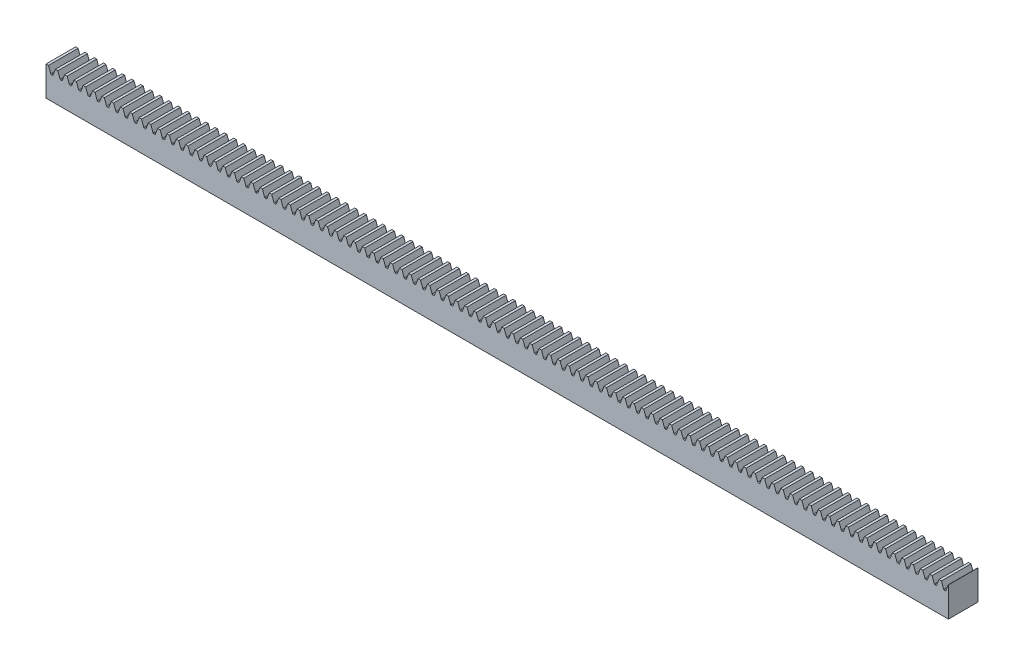
from build123d import *

# Parameters (mm, degrees)
BOSS_EXTRUDE1_DEPTH      = 152.4
BOSS_EXTRUDE1_DEPTH_BACK = 152.4
SKETCH3_W                = 10
SKETCH3_H                = 10
CUT_EXTRUDE1_DEPTH       = 153.563953803
FILLET1_R                = 0.209179931
LPATTERN1_START          = -5
LPATTERN1_DEPTH          = 10


# Read off the part's stored shape, not the designer's step: LPattern1
with BuildPart() as part:
    # Sketch3 → Boss-Extrude1 (new, two sides: drawn at the far end of the back side and taken through both)
    with BuildSketch(Plane(origin=(0, 0, 0), x_dir=(0, 0, -1), z_dir=(1, 0, 0)).offset(-BOSS_EXTRUDE1_DEPTH_BACK)):
        Rectangle(SKETCH3_W, SKETCH3_H)
    extrude(amount=BOSS_EXTRUDE1_DEPTH + BOSS_EXTRUDE1_DEPTH_BACK)

    # Sketch4 → Cut-Extrude1 (cut, symmetric)
    with BuildSketch(Plane.XY):
        Polygon((-151.557145469, 5), (-150.756410953, 2.8), (-150.059144515, 2.8), (-149.25841, 5), align=None)
    extrude(amount=CUT_EXTRUDE1_DEPTH, both=True, mode=Mode.SUBTRACT)

    # Fillet1
    fillet1_edges = [part.edges().sort_by_distance(p)[0] for p in [
        (-150.059144515, 2.8, 0),
        (-150.756410953, 2.8, 0),
    ]]
    fillet(fillet1_edges, radius=FILLET1_R)

    # LPattern1 outline → LPattern1 (cut)
    with BuildSketch(Plane.XY.offset(LPATTERN1_START)):
        with BuildLine():
            ThreePointArc((-147.664916426, 2.937636181), (-147.588332268, 2.837829763), (-147.468351588, 2.8))
            Line((-147.468351588, 2.8), (-147.06402388, 2.8))
            ThreePointArc((-147.06402388, 2.8), (-146.944043201, 2.837829763), (-146.867459042, 2.937636181))
            Line((-146.867459042, 2.937636181), (-146.11682, 5))
            Line((-146.11682, 5), (-148.415555469, 5))
            Line((-148.415555469, 5), (-147.664916426, 2.937636181))
        make_face()
        with BuildLine():
            Line((152.33423, 5), (150.035494531, 5))
            Line((150.035494531, 5), (150.786133574, 2.937636181))
            ThreePointArc((150.786133574, 2.937636181), (150.862717732, 2.837829763), (150.982698412, 2.8))
            Line((150.982698412, 2.8), (151.38702612, 2.8))
            ThreePointArc((151.38702612, 2.8), (151.507006799, 2.837829763), (151.583590958, 2.937636181))
            Line((151.583590958, 2.937636181), (152.33423, 5))
        make_face()
        with BuildLine():
            Line((149.19264, 5), (146.893904531, 5))
            Line((146.893904531, 5), (147.644543574, 2.937636181))
            ThreePointArc((147.644543574, 2.937636181), (147.721127732, 2.837829763), (147.841108412, 2.8))
            Line((147.841108412, 2.8), (148.24543612, 2.8))
            ThreePointArc((148.24543612, 2.8), (148.365416799, 2.837829763), (148.442000958, 2.937636181))
            Line((148.442000958, 2.937636181), (149.19264, 5))
        make_face()
        with BuildLine():
            Line((146.05105, 5), (143.752314531, 5))
            Line((143.752314531, 5), (144.502953574, 2.937636181))
            ThreePointArc((144.502953574, 2.937636181), (144.579537732, 2.837829763), (144.699518412, 2.8))
            Line((144.699518412, 2.8), (145.10384612, 2.8))
            ThreePointArc((145.10384612, 2.8), (145.223826799, 2.837829763), (145.300410958, 2.937636181))
            Line((145.300410958, 2.937636181), (146.05105, 5))
        make_face()
        with BuildLine():
            Line((142.90946, 5), (140.610724531, 5))
            Line((140.610724531, 5), (141.361363574, 2.937636181))
            ThreePointArc((141.361363574, 2.937636181), (141.437947732, 2.837829763), (141.557928412, 2.8))
            Line((141.557928412, 2.8), (141.96225612, 2.8))
            ThreePointArc((141.96225612, 2.8), (142.082236799, 2.837829763), (142.158820958, 2.937636181))
            Line((142.158820958, 2.937636181), (142.90946, 5))
        make_face()
        with BuildLine():
            Line((139.76787, 5), (137.469134531, 5))
            Line((137.469134531, 5), (138.219773574, 2.937636181))
            ThreePointArc((138.219773574, 2.937636181), (138.296357732, 2.837829763), (138.416338412, 2.8))
            Line((138.416338412, 2.8), (138.82066612, 2.8))
            ThreePointArc((138.82066612, 2.8), (138.940646799, 2.837829763), (139.017230958, 2.937636181))
            Line((139.017230958, 2.937636181), (139.76787, 5))
        make_face()
        with BuildLine():
            Line((136.62628, 5), (134.327544531, 5))
            Line((134.327544531, 5), (135.078183574, 2.937636181))
            ThreePointArc((135.078183574, 2.937636181), (135.154767732, 2.837829763), (135.274748412, 2.8))
            Line((135.274748412, 2.8), (135.67907612, 2.8))
            ThreePointArc((135.67907612, 2.8), (135.799056799, 2.837829763), (135.875640958, 2.937636181))
            Line((135.875640958, 2.937636181), (136.62628, 5))
        make_face()
        with BuildLine():
            Line((133.48469, 5), (131.185954531, 5))
            Line((131.185954531, 5), (131.936593574, 2.937636181))
            ThreePointArc((131.936593574, 2.937636181), (132.013177732, 2.837829763), (132.133158412, 2.8))
            Line((132.133158412, 2.8), (132.53748612, 2.8))
            ThreePointArc((132.53748612, 2.8), (132.657466799, 2.837829763), (132.734050958, 2.937636181))
            Line((132.734050958, 2.937636181), (133.48469, 5))
        make_face()
        with BuildLine():
            Line((130.3431, 5), (128.044364531, 5))
            Line((128.044364531, 5), (128.795003574, 2.937636181))
            ThreePointArc((128.795003574, 2.937636181), (128.871587732, 2.837829763), (128.991568412, 2.8))
            Line((128.991568412, 2.8), (129.39589612, 2.8))
            ThreePointArc((129.39589612, 2.8), (129.515876799, 2.837829763), (129.592460958, 2.937636181))
            Line((129.592460958, 2.937636181), (130.3431, 5))
        make_face()
        with BuildLine():
            Line((127.20151, 5), (124.902774531, 5))
            Line((124.902774531, 5), (125.653413574, 2.937636181))
            ThreePointArc((125.653413574, 2.937636181), (125.729997732, 2.837829763), (125.849978412, 2.8))
            Line((125.849978412, 2.8), (126.25430612, 2.8))
            ThreePointArc((126.25430612, 2.8), (126.374286799, 2.837829763), (126.450870958, 2.937636181))
            Line((126.450870958, 2.937636181), (127.20151, 5))
        make_face()
        with BuildLine():
            Line((124.05992, 5), (121.761184531, 5))
            Line((121.761184531, 5), (122.511823574, 2.937636181))
            ThreePointArc((122.511823574, 2.937636181), (122.588407732, 2.837829763), (122.708388412, 2.8))
            Line((122.708388412, 2.8), (123.11271612, 2.8))
            ThreePointArc((123.11271612, 2.8), (123.232696799, 2.837829763), (123.309280958, 2.937636181))
            Line((123.309280958, 2.937636181), (124.05992, 5))
        make_face()
        with BuildLine():
            Line((120.91833, 5), (118.619594531, 5))
            Line((118.619594531, 5), (119.370233574, 2.937636181))
            ThreePointArc((119.370233574, 2.937636181), (119.446817732, 2.837829763), (119.566798412, 2.8))
            Line((119.566798412, 2.8), (119.97112612, 2.8))
            ThreePointArc((119.97112612, 2.8), (120.091106799, 2.837829763), (120.167690958, 2.937636181))
            Line((120.167690958, 2.937636181), (120.91833, 5))
        make_face()
        with BuildLine():
            Line((117.77674, 5), (115.478004531, 5))
            Line((115.478004531, 5), (116.228643574, 2.937636181))
            ThreePointArc((116.228643574, 2.937636181), (116.305227732, 2.837829763), (116.425208412, 2.8))
            Line((116.425208412, 2.8), (116.82953612, 2.8))
            ThreePointArc((116.82953612, 2.8), (116.949516799, 2.837829763), (117.026100958, 2.937636181))
            Line((117.026100958, 2.937636181), (117.77674, 5))
        make_face()
        with BuildLine():
            Line((114.63515, 5), (112.336414531, 5))
            Line((112.336414531, 5), (113.087053574, 2.937636181))
            ThreePointArc((113.087053574, 2.937636181), (113.163637732, 2.837829763), (113.283618412, 2.8))
            Line((113.283618412, 2.8), (113.68794612, 2.8))
            ThreePointArc((113.68794612, 2.8), (113.807926799, 2.837829763), (113.884510958, 2.937636181))
            Line((113.884510958, 2.937636181), (114.63515, 5))
        make_face()
        with BuildLine():
            Line((111.49356, 5), (109.194824531, 5))
            Line((109.194824531, 5), (109.945463574, 2.937636181))
            ThreePointArc((109.945463574, 2.937636181), (110.022047732, 2.837829763), (110.142028412, 2.8))
            Line((110.142028412, 2.8), (110.54635612, 2.8))
            ThreePointArc((110.54635612, 2.8), (110.666336799, 2.837829763), (110.742920958, 2.937636181))
            Line((110.742920958, 2.937636181), (111.49356, 5))
        make_face()
        with BuildLine():
            Line((108.35197, 5), (106.053234531, 5))
            Line((106.053234531, 5), (106.803873574, 2.937636181))
            ThreePointArc((106.803873574, 2.937636181), (106.880457732, 2.837829763), (107.000438412, 2.8))
            Line((107.000438412, 2.8), (107.40476612, 2.8))
            ThreePointArc((107.40476612, 2.8), (107.524746799, 2.837829763), (107.601330958, 2.937636181))
            Line((107.601330958, 2.937636181), (108.35197, 5))
        make_face()
        with BuildLine():
            Line((105.21038, 5), (102.911644531, 5))
            Line((102.911644531, 5), (103.662283574, 2.937636181))
            ThreePointArc((103.662283574, 2.937636181), (103.738867732, 2.837829763), (103.858848412, 2.8))
            Line((103.858848412, 2.8), (104.26317612, 2.8))
            ThreePointArc((104.26317612, 2.8), (104.383156799, 2.837829763), (104.459740958, 2.937636181))
            Line((104.459740958, 2.937636181), (105.21038, 5))
        make_face()
        with BuildLine():
            Line((102.06879, 5), (99.770054531, 5))
            Line((99.770054531, 5), (100.520693574, 2.937636181))
            ThreePointArc((100.520693574, 2.937636181), (100.597277732, 2.837829763), (100.717258412, 2.8))
            Line((100.717258412, 2.8), (101.12158612, 2.8))
            ThreePointArc((101.12158612, 2.8), (101.241566799, 2.837829763), (101.318150958, 2.937636181))
            Line((101.318150958, 2.937636181), (102.06879, 5))
        make_face()
        with BuildLine():
            Line((98.9272, 5), (96.628464531, 5))
            Line((96.628464531, 5), (97.379103574, 2.937636181))
            ThreePointArc((97.379103574, 2.937636181), (97.455687732, 2.837829763), (97.575668412, 2.8))
            Line((97.575668412, 2.8), (97.97999612, 2.8))
            ThreePointArc((97.97999612, 2.8), (98.099976799, 2.837829763), (98.176560958, 2.937636181))
            Line((98.176560958, 2.937636181), (98.9272, 5))
        make_face()
        with BuildLine():
            Line((95.78561, 5), (93.486874531, 5))
            Line((93.486874531, 5), (94.237513574, 2.937636181))
            ThreePointArc((94.237513574, 2.937636181), (94.314097732, 2.837829763), (94.434078412, 2.8))
            Line((94.434078412, 2.8), (94.83840612, 2.8))
            ThreePointArc((94.83840612, 2.8), (94.958386799, 2.837829763), (95.034970958, 2.937636181))
            Line((95.034970958, 2.937636181), (95.78561, 5))
        make_face()
        with BuildLine():
            Line((92.64402, 5), (90.345284531, 5))
            Line((90.345284531, 5), (91.095923574, 2.937636181))
            ThreePointArc((91.095923574, 2.937636181), (91.172507732, 2.837829763), (91.292488412, 2.8))
            Line((91.292488412, 2.8), (91.69681612, 2.8))
            ThreePointArc((91.69681612, 2.8), (91.816796799, 2.837829763), (91.893380958, 2.937636181))
            Line((91.893380958, 2.937636181), (92.64402, 5))
        make_face()
        with BuildLine():
            Line((89.50243, 5), (87.203694531, 5))
            Line((87.203694531, 5), (87.954333574, 2.937636181))
            ThreePointArc((87.954333574, 2.937636181), (88.030917732, 2.837829763), (88.150898412, 2.8))
            Line((88.150898412, 2.8), (88.55522612, 2.8))
            ThreePointArc((88.55522612, 2.8), (88.675206799, 2.837829763), (88.751790958, 2.937636181))
            Line((88.751790958, 2.937636181), (89.50243, 5))
        make_face()
        with BuildLine():
            Line((86.36084, 5), (84.062104531, 5))
            Line((84.062104531, 5), (84.812743574, 2.937636181))
            ThreePointArc((84.812743574, 2.937636181), (84.889327732, 2.837829763), (85.009308412, 2.8))
            Line((85.009308412, 2.8), (85.41363612, 2.8))
            ThreePointArc((85.41363612, 2.8), (85.533616799, 2.837829763), (85.610200958, 2.937636181))
            Line((85.610200958, 2.937636181), (86.36084, 5))
        make_face()
        with BuildLine():
            Line((83.21925, 5), (80.920514531, 5))
            Line((80.920514531, 5), (81.671153574, 2.937636181))
            ThreePointArc((81.671153574, 2.937636181), (81.747737732, 2.837829763), (81.867718412, 2.8))
            Line((81.867718412, 2.8), (82.27204612, 2.8))
            ThreePointArc((82.27204612, 2.8), (82.392026799, 2.837829763), (82.468610958, 2.937636181))
            Line((82.468610958, 2.937636181), (83.21925, 5))
        make_face()
        with BuildLine():
            Line((80.07766, 5), (77.778924531, 5))
            Line((77.778924531, 5), (78.529563574, 2.937636181))
            ThreePointArc((78.529563574, 2.937636181), (78.606147732, 2.837829763), (78.726128412, 2.8))
            Line((78.726128412, 2.8), (79.13045612, 2.8))
            ThreePointArc((79.13045612, 2.8), (79.250436799, 2.837829763), (79.327020958, 2.937636181))
            Line((79.327020958, 2.937636181), (80.07766, 5))
        make_face()
        with BuildLine():
            Line((76.93607, 5), (74.637334531, 5))
            Line((74.637334531, 5), (75.387973574, 2.937636181))
            ThreePointArc((75.387973574, 2.937636181), (75.464557732, 2.837829763), (75.584538412, 2.8))
            Line((75.584538412, 2.8), (75.98886612, 2.8))
            ThreePointArc((75.98886612, 2.8), (76.108846799, 2.837829763), (76.185430958, 2.937636181))
            Line((76.185430958, 2.937636181), (76.93607, 5))
        make_face()
        with BuildLine():
            Line((73.79448, 5), (71.495744531, 5))
            Line((71.495744531, 5), (72.246383574, 2.937636181))
            ThreePointArc((72.246383574, 2.937636181), (72.322967732, 2.837829763), (72.442948412, 2.8))
            Line((72.442948412, 2.8), (72.84727612, 2.8))
            ThreePointArc((72.84727612, 2.8), (72.967256799, 2.837829763), (73.043840958, 2.937636181))
            Line((73.043840958, 2.937636181), (73.79448, 5))
        make_face()
        with BuildLine():
            Line((70.65289, 5), (68.354154531, 5))
            Line((68.354154531, 5), (69.104793574, 2.937636181))
            ThreePointArc((69.104793574, 2.937636181), (69.181377732, 2.837829763), (69.301358412, 2.8))
            Line((69.301358412, 2.8), (69.70568612, 2.8))
            ThreePointArc((69.70568612, 2.8), (69.825666799, 2.837829763), (69.902250958, 2.937636181))
            Line((69.902250958, 2.937636181), (70.65289, 5))
        make_face()
        with BuildLine():
            Line((67.5113, 5), (65.212564531, 5))
            Line((65.212564531, 5), (65.963203574, 2.937636181))
            ThreePointArc((65.963203574, 2.937636181), (66.039787732, 2.837829763), (66.159768412, 2.8))
            Line((66.159768412, 2.8), (66.56409612, 2.8))
            ThreePointArc((66.56409612, 2.8), (66.684076799, 2.837829763), (66.760660958, 2.937636181))
            Line((66.760660958, 2.937636181), (67.5113, 5))
        make_face()
        with BuildLine():
            Line((64.36971, 5), (62.070974531, 5))
            Line((62.070974531, 5), (62.821613574, 2.937636181))
            ThreePointArc((62.821613574, 2.937636181), (62.898197732, 2.837829763), (63.018178412, 2.8))
            Line((63.018178412, 2.8), (63.42250612, 2.8))
            ThreePointArc((63.42250612, 2.8), (63.542486799, 2.837829763), (63.619070958, 2.937636181))
            Line((63.619070958, 2.937636181), (64.36971, 5))
        make_face()
        with BuildLine():
            Line((61.22812, 5), (58.929384531, 5))
            Line((58.929384531, 5), (59.680023574, 2.937636181))
            ThreePointArc((59.680023574, 2.937636181), (59.756607732, 2.837829763), (59.876588412, 2.8))
            Line((59.876588412, 2.8), (60.28091612, 2.8))
            ThreePointArc((60.28091612, 2.8), (60.400896799, 2.837829763), (60.477480958, 2.937636181))
            Line((60.477480958, 2.937636181), (61.22812, 5))
        make_face()
        with BuildLine():
            Line((58.08653, 5), (55.787794531, 5))
            Line((55.787794531, 5), (56.538433574, 2.937636181))
            ThreePointArc((56.538433574, 2.937636181), (56.615017732, 2.837829763), (56.734998412, 2.8))
            Line((56.734998412, 2.8), (57.13932612, 2.8))
            ThreePointArc((57.13932612, 2.8), (57.259306799, 2.837829763), (57.335890958, 2.937636181))
            Line((57.335890958, 2.937636181), (58.08653, 5))
        make_face()
        with BuildLine():
            Line((54.94494, 5), (52.646204531, 5))
            Line((52.646204531, 5), (53.396843574, 2.937636181))
            ThreePointArc((53.396843574, 2.937636181), (53.473427732, 2.837829763), (53.593408412, 2.8))
            Line((53.593408412, 2.8), (53.99773612, 2.8))
            ThreePointArc((53.99773612, 2.8), (54.117716799, 2.837829763), (54.194300958, 2.937636181))
            Line((54.194300958, 2.937636181), (54.94494, 5))
        make_face()
        with BuildLine():
            Line((51.80335, 5), (49.504614531, 5))
            Line((49.504614531, 5), (50.255253574, 2.937636181))
            ThreePointArc((50.255253574, 2.937636181), (50.331837732, 2.837829763), (50.451818412, 2.8))
            Line((50.451818412, 2.8), (50.85614612, 2.8))
            ThreePointArc((50.85614612, 2.8), (50.976126799, 2.837829763), (51.052710958, 2.937636181))
            Line((51.052710958, 2.937636181), (51.80335, 5))
        make_face()
        with BuildLine():
            Line((48.66176, 5), (46.363024531, 5))
            Line((46.363024531, 5), (47.113663574, 2.937636181))
            ThreePointArc((47.113663574, 2.937636181), (47.190247732, 2.837829763), (47.310228412, 2.8))
            Line((47.310228412, 2.8), (47.71455612, 2.8))
            ThreePointArc((47.71455612, 2.8), (47.834536799, 2.837829763), (47.911120958, 2.937636181))
            Line((47.911120958, 2.937636181), (48.66176, 5))
        make_face()
        with BuildLine():
            Line((45.52017, 5), (43.221434531, 5))
            Line((43.221434531, 5), (43.972073574, 2.937636181))
            ThreePointArc((43.972073574, 2.937636181), (44.048657732, 2.837829763), (44.168638412, 2.8))
            Line((44.168638412, 2.8), (44.57296612, 2.8))
            ThreePointArc((44.57296612, 2.8), (44.692946799, 2.837829763), (44.769530958, 2.937636181))
            Line((44.769530958, 2.937636181), (45.52017, 5))
        make_face()
        with BuildLine():
            Line((42.37858, 5), (40.079844531, 5))
            Line((40.079844531, 5), (40.830483574, 2.937636181))
            ThreePointArc((40.830483574, 2.937636181), (40.907067732, 2.837829763), (41.027048412, 2.8))
            Line((41.027048412, 2.8), (41.43137612, 2.8))
            ThreePointArc((41.43137612, 2.8), (41.551356799, 2.837829763), (41.627940958, 2.937636181))
            Line((41.627940958, 2.937636181), (42.37858, 5))
        make_face()
        with BuildLine():
            Line((39.23699, 5), (36.938254531, 5))
            Line((36.938254531, 5), (37.688893574, 2.937636181))
            ThreePointArc((37.688893574, 2.937636181), (37.765477732, 2.837829763), (37.885458412, 2.8))
            Line((37.885458412, 2.8), (38.28978612, 2.8))
            ThreePointArc((38.28978612, 2.8), (38.409766799, 2.837829763), (38.486350958, 2.937636181))
            Line((38.486350958, 2.937636181), (39.23699, 5))
        make_face()
        with BuildLine():
            Line((36.0954, 5), (33.796664531, 5))
            Line((33.796664531, 5), (34.547303574, 2.937636181))
            ThreePointArc((34.547303574, 2.937636181), (34.623887732, 2.837829763), (34.743868412, 2.8))
            Line((34.743868412, 2.8), (35.14819612, 2.8))
            ThreePointArc((35.14819612, 2.8), (35.268176799, 2.837829763), (35.344760958, 2.937636181))
            Line((35.344760958, 2.937636181), (36.0954, 5))
        make_face()
        with BuildLine():
            Line((32.95381, 5), (30.655074531, 5))
            Line((30.655074531, 5), (31.405713574, 2.937636181))
            ThreePointArc((31.405713574, 2.937636181), (31.482297732, 2.837829763), (31.602278412, 2.8))
            Line((31.602278412, 2.8), (32.00660612, 2.8))
            ThreePointArc((32.00660612, 2.8), (32.126586799, 2.837829763), (32.203170958, 2.937636181))
            Line((32.203170958, 2.937636181), (32.95381, 5))
        make_face()
        with BuildLine():
            Line((29.81222, 5), (27.513484531, 5))
            Line((27.513484531, 5), (28.264123574, 2.937636181))
            ThreePointArc((28.264123574, 2.937636181), (28.340707732, 2.837829763), (28.460688412, 2.8))
            Line((28.460688412, 2.8), (28.86501612, 2.8))
            ThreePointArc((28.86501612, 2.8), (28.984996799, 2.837829763), (29.061580958, 2.937636181))
            Line((29.061580958, 2.937636181), (29.81222, 5))
        make_face()
        with BuildLine():
            Line((26.67063, 5), (24.371894531, 5))
            Line((24.371894531, 5), (25.122533574, 2.937636181))
            ThreePointArc((25.122533574, 2.937636181), (25.199117732, 2.837829763), (25.319098412, 2.8))
            Line((25.319098412, 2.8), (25.72342612, 2.8))
            ThreePointArc((25.72342612, 2.8), (25.843406799, 2.837829763), (25.919990958, 2.937636181))
            Line((25.919990958, 2.937636181), (26.67063, 5))
        make_face()
        with BuildLine():
            Line((23.52904, 5), (21.230304531, 5))
            Line((21.230304531, 5), (21.980943574, 2.937636181))
            ThreePointArc((21.980943574, 2.937636181), (22.057527732, 2.837829763), (22.177508412, 2.8))
            Line((22.177508412, 2.8), (22.58183612, 2.8))
            ThreePointArc((22.58183612, 2.8), (22.701816799, 2.837829763), (22.778400958, 2.937636181))
            Line((22.778400958, 2.937636181), (23.52904, 5))
        make_face()
        with BuildLine():
            Line((20.38745, 5), (18.088714531, 5))
            Line((18.088714531, 5), (18.839353574, 2.937636181))
            ThreePointArc((18.839353574, 2.937636181), (18.915937732, 2.837829763), (19.035918412, 2.8))
            Line((19.035918412, 2.8), (19.44024612, 2.8))
            ThreePointArc((19.44024612, 2.8), (19.560226799, 2.837829763), (19.636810958, 2.937636181))
            Line((19.636810958, 2.937636181), (20.38745, 5))
        make_face()
        with BuildLine():
            Line((17.24586, 5), (14.947124531, 5))
            Line((14.947124531, 5), (15.697763574, 2.937636181))
            ThreePointArc((15.697763574, 2.937636181), (15.774347732, 2.837829763), (15.894328412, 2.8))
            Line((15.894328412, 2.8), (16.29865612, 2.8))
            ThreePointArc((16.29865612, 2.8), (16.418636799, 2.837829763), (16.495220958, 2.937636181))
            Line((16.495220958, 2.937636181), (17.24586, 5))
        make_face()
        with BuildLine():
            Line((14.10427, 5), (11.805534531, 5))
            Line((11.805534531, 5), (12.556173574, 2.937636181))
            ThreePointArc((12.556173574, 2.937636181), (12.632757732, 2.837829763), (12.752738412, 2.8))
            Line((12.752738412, 2.8), (13.15706612, 2.8))
            ThreePointArc((13.15706612, 2.8), (13.277046799, 2.837829763), (13.353630958, 2.937636181))
            Line((13.353630958, 2.937636181), (14.10427, 5))
        make_face()
        with BuildLine():
            Line((10.96268, 5), (8.663944531, 5))
            Line((8.663944531, 5), (9.414583574, 2.937636181))
            ThreePointArc((9.414583574, 2.937636181), (9.491167732, 2.837829763), (9.611148412, 2.8))
            Line((9.611148412, 2.8), (10.01547612, 2.8))
            ThreePointArc((10.01547612, 2.8), (10.135456799, 2.837829763), (10.212040958, 2.937636181))
            Line((10.212040958, 2.937636181), (10.96268, 5))
        make_face()
        with BuildLine():
            Line((7.82109, 5), (5.522354531, 5))
            Line((5.522354531, 5), (6.272993574, 2.937636181))
            ThreePointArc((6.272993574, 2.937636181), (6.349577732, 2.837829763), (6.469558412, 2.8))
            Line((6.469558412, 2.8), (6.87388612, 2.8))
            ThreePointArc((6.87388612, 2.8), (6.993866799, 2.837829763), (7.070450958, 2.937636181))
            Line((7.070450958, 2.937636181), (7.82109, 5))
        make_face()
        with BuildLine():
            Line((4.6795, 5), (2.380764531, 5))
            Line((2.380764531, 5), (3.131403574, 2.937636181))
            ThreePointArc((3.131403574, 2.937636181), (3.207987732, 2.837829763), (3.327968412, 2.8))
            Line((3.327968412, 2.8), (3.73229612, 2.8))
            ThreePointArc((3.73229612, 2.8), (3.852276799, 2.837829763), (3.928860958, 2.937636181))
            Line((3.928860958, 2.937636181), (4.6795, 5))
        make_face()
        with BuildLine():
            Line((1.53791, 5), (-0.760825469, 5))
            Line((-0.760825469, 5), (-0.010186426, 2.937636181))
            ThreePointArc((-0.010186426, 2.937636181), (0.066397732, 2.837829763), (0.186378412, 2.8))
            Line((0.186378412, 2.8), (0.59070612, 2.8))
            ThreePointArc((0.59070612, 2.8), (0.710686799, 2.837829763), (0.787270958, 2.937636181))
            Line((0.787270958, 2.937636181), (1.53791, 5))
        make_face()
        with BuildLine():
            Line((-1.60368, 5), (-3.902415469, 5))
            Line((-3.902415469, 5), (-3.151776426, 2.937636181))
            ThreePointArc((-3.151776426, 2.937636181), (-3.075192268, 2.837829763), (-2.955211588, 2.8))
            Line((-2.955211588, 2.8), (-2.55088388, 2.8))
            ThreePointArc((-2.55088388, 2.8), (-2.430903201, 2.837829763), (-2.354319042, 2.937636181))
            Line((-2.354319042, 2.937636181), (-1.60368, 5))
        make_face()
        with BuildLine():
            Line((-4.74527, 5), (-7.044005469, 5))
            Line((-7.044005469, 5), (-6.293366426, 2.937636181))
            ThreePointArc((-6.293366426, 2.937636181), (-6.216782268, 2.837829763), (-6.096801588, 2.8))
            Line((-6.096801588, 2.8), (-5.69247388, 2.8))
            ThreePointArc((-5.69247388, 2.8), (-5.572493201, 2.837829763), (-5.495909042, 2.937636181))
            Line((-5.495909042, 2.937636181), (-4.74527, 5))
        make_face()
        with BuildLine():
            Line((-7.88686, 5), (-10.185595469, 5))
            Line((-10.185595469, 5), (-9.434956426, 2.937636181))
            ThreePointArc((-9.434956426, 2.937636181), (-9.358372268, 2.837829763), (-9.238391588, 2.8))
            Line((-9.238391588, 2.8), (-8.83406388, 2.8))
            ThreePointArc((-8.83406388, 2.8), (-8.714083201, 2.837829763), (-8.637499042, 2.937636181))
            Line((-8.637499042, 2.937636181), (-7.88686, 5))
        make_face()
        with BuildLine():
            Line((-11.02845, 5), (-13.327185469, 5))
            Line((-13.327185469, 5), (-12.576546426, 2.937636181))
            ThreePointArc((-12.576546426, 2.937636181), (-12.499962268, 2.837829763), (-12.379981588, 2.8))
            Line((-12.379981588, 2.8), (-11.97565388, 2.8))
            ThreePointArc((-11.97565388, 2.8), (-11.855673201, 2.837829763), (-11.779089042, 2.937636181))
            Line((-11.779089042, 2.937636181), (-11.02845, 5))
        make_face()
        with BuildLine():
            Line((-14.17004, 5), (-16.468775469, 5))
            Line((-16.468775469, 5), (-15.718136426, 2.937636181))
            ThreePointArc((-15.718136426, 2.937636181), (-15.641552268, 2.837829763), (-15.521571588, 2.8))
            Line((-15.521571588, 2.8), (-15.11724388, 2.8))
            ThreePointArc((-15.11724388, 2.8), (-14.997263201, 2.837829763), (-14.920679042, 2.937636181))
            Line((-14.920679042, 2.937636181), (-14.17004, 5))
        make_face()
        with BuildLine():
            Line((-17.31163, 5), (-19.610365469, 5))
            Line((-19.610365469, 5), (-18.859726426, 2.937636181))
            ThreePointArc((-18.859726426, 2.937636181), (-18.783142268, 2.837829763), (-18.663161588, 2.8))
            Line((-18.663161588, 2.8), (-18.25883388, 2.8))
            ThreePointArc((-18.25883388, 2.8), (-18.138853201, 2.837829763), (-18.062269042, 2.937636181))
            Line((-18.062269042, 2.937636181), (-17.31163, 5))
        make_face()
        with BuildLine():
            Line((-20.45322, 5), (-22.751955469, 5))
            Line((-22.751955469, 5), (-22.001316426, 2.937636181))
            ThreePointArc((-22.001316426, 2.937636181), (-21.924732268, 2.837829763), (-21.804751588, 2.8))
            Line((-21.804751588, 2.8), (-21.40042388, 2.8))
            ThreePointArc((-21.40042388, 2.8), (-21.280443201, 2.837829763), (-21.203859042, 2.937636181))
            Line((-21.203859042, 2.937636181), (-20.45322, 5))
        make_face()
        with BuildLine():
            Line((-23.59481, 5), (-25.893545469, 5))
            Line((-25.893545469, 5), (-25.142906426, 2.937636181))
            ThreePointArc((-25.142906426, 2.937636181), (-25.066322268, 2.837829763), (-24.946341588, 2.8))
            Line((-24.946341588, 2.8), (-24.54201388, 2.8))
            ThreePointArc((-24.54201388, 2.8), (-24.422033201, 2.837829763), (-24.345449042, 2.937636181))
            Line((-24.345449042, 2.937636181), (-23.59481, 5))
        make_face()
        with BuildLine():
            Line((-26.7364, 5), (-29.035135469, 5))
            Line((-29.035135469, 5), (-28.284496426, 2.937636181))
            ThreePointArc((-28.284496426, 2.937636181), (-28.207912268, 2.837829763), (-28.087931588, 2.8))
            Line((-28.087931588, 2.8), (-27.68360388, 2.8))
            ThreePointArc((-27.68360388, 2.8), (-27.563623201, 2.837829763), (-27.487039042, 2.937636181))
            Line((-27.487039042, 2.937636181), (-26.7364, 5))
        make_face()
        with BuildLine():
            Line((-29.87799, 5), (-32.176725469, 5))
            Line((-32.176725469, 5), (-31.426086426, 2.937636181))
            ThreePointArc((-31.426086426, 2.937636181), (-31.349502268, 2.837829763), (-31.229521588, 2.8))
            Line((-31.229521588, 2.8), (-30.82519388, 2.8))
            ThreePointArc((-30.82519388, 2.8), (-30.705213201, 2.837829763), (-30.628629042, 2.937636181))
            Line((-30.628629042, 2.937636181), (-29.87799, 5))
        make_face()
        with BuildLine():
            Line((-33.01958, 5), (-35.318315469, 5))
            Line((-35.318315469, 5), (-34.567676426, 2.937636181))
            ThreePointArc((-34.567676426, 2.937636181), (-34.491092268, 2.837829763), (-34.371111588, 2.8))
            Line((-34.371111588, 2.8), (-33.96678388, 2.8))
            ThreePointArc((-33.96678388, 2.8), (-33.846803201, 2.837829763), (-33.770219042, 2.937636181))
            Line((-33.770219042, 2.937636181), (-33.01958, 5))
        make_face()
        with BuildLine():
            Line((-36.16117, 5), (-38.459905469, 5))
            Line((-38.459905469, 5), (-37.709266426, 2.937636181))
            ThreePointArc((-37.709266426, 2.937636181), (-37.632682268, 2.837829763), (-37.512701588, 2.8))
            Line((-37.512701588, 2.8), (-37.10837388, 2.8))
            ThreePointArc((-37.10837388, 2.8), (-36.988393201, 2.837829763), (-36.911809042, 2.937636181))
            Line((-36.911809042, 2.937636181), (-36.16117, 5))
        make_face()
        with BuildLine():
            Line((-39.30276, 5), (-41.601495469, 5))
            Line((-41.601495469, 5), (-40.850856426, 2.937636181))
            ThreePointArc((-40.850856426, 2.937636181), (-40.774272268, 2.837829763), (-40.654291588, 2.8))
            Line((-40.654291588, 2.8), (-40.24996388, 2.8))
            ThreePointArc((-40.24996388, 2.8), (-40.129983201, 2.837829763), (-40.053399042, 2.937636181))
            Line((-40.053399042, 2.937636181), (-39.30276, 5))
        make_face()
        with BuildLine():
            Line((-42.44435, 5), (-44.743085469, 5))
            Line((-44.743085469, 5), (-43.992446426, 2.937636181))
            ThreePointArc((-43.992446426, 2.937636181), (-43.915862268, 2.837829763), (-43.795881588, 2.8))
            Line((-43.795881588, 2.8), (-43.39155388, 2.8))
            ThreePointArc((-43.39155388, 2.8), (-43.271573201, 2.837829763), (-43.194989042, 2.937636181))
            Line((-43.194989042, 2.937636181), (-42.44435, 5))
        make_face()
        with BuildLine():
            Line((-45.58594, 5), (-47.884675469, 5))
            Line((-47.884675469, 5), (-47.134036426, 2.937636181))
            ThreePointArc((-47.134036426, 2.937636181), (-47.057452268, 2.837829763), (-46.937471588, 2.8))
            Line((-46.937471588, 2.8), (-46.53314388, 2.8))
            ThreePointArc((-46.53314388, 2.8), (-46.413163201, 2.837829763), (-46.336579042, 2.937636181))
            Line((-46.336579042, 2.937636181), (-45.58594, 5))
        make_face()
        with BuildLine():
            Line((-48.72753, 5), (-51.026265469, 5))
            Line((-51.026265469, 5), (-50.275626426, 2.937636181))
            ThreePointArc((-50.275626426, 2.937636181), (-50.199042268, 2.837829763), (-50.079061588, 2.8))
            Line((-50.079061588, 2.8), (-49.67473388, 2.8))
            ThreePointArc((-49.67473388, 2.8), (-49.554753201, 2.837829763), (-49.478169042, 2.937636181))
            Line((-49.478169042, 2.937636181), (-48.72753, 5))
        make_face()
        with BuildLine():
            Line((-51.86912, 5), (-54.167855469, 5))
            Line((-54.167855469, 5), (-53.417216426, 2.937636181))
            ThreePointArc((-53.417216426, 2.937636181), (-53.340632268, 2.837829763), (-53.220651588, 2.8))
            Line((-53.220651588, 2.8), (-52.81632388, 2.8))
            ThreePointArc((-52.81632388, 2.8), (-52.696343201, 2.837829763), (-52.619759042, 2.937636181))
            Line((-52.619759042, 2.937636181), (-51.86912, 5))
        make_face()
        with BuildLine():
            Line((-55.01071, 5), (-57.309445469, 5))
            Line((-57.309445469, 5), (-56.558806426, 2.937636181))
            ThreePointArc((-56.558806426, 2.937636181), (-56.482222268, 2.837829763), (-56.362241588, 2.8))
            Line((-56.362241588, 2.8), (-55.95791388, 2.8))
            ThreePointArc((-55.95791388, 2.8), (-55.837933201, 2.837829763), (-55.761349042, 2.937636181))
            Line((-55.761349042, 2.937636181), (-55.01071, 5))
        make_face()
        with BuildLine():
            Line((-58.1523, 5), (-60.451035469, 5))
            Line((-60.451035469, 5), (-59.700396426, 2.937636181))
            ThreePointArc((-59.700396426, 2.937636181), (-59.623812268, 2.837829763), (-59.503831588, 2.8))
            Line((-59.503831588, 2.8), (-59.09950388, 2.8))
            ThreePointArc((-59.09950388, 2.8), (-58.979523201, 2.837829763), (-58.902939042, 2.937636181))
            Line((-58.902939042, 2.937636181), (-58.1523, 5))
        make_face()
        with BuildLine():
            Line((-61.29389, 5), (-63.592625469, 5))
            Line((-63.592625469, 5), (-62.841986426, 2.937636181))
            ThreePointArc((-62.841986426, 2.937636181), (-62.765402268, 2.837829763), (-62.645421588, 2.8))
            Line((-62.645421588, 2.8), (-62.24109388, 2.8))
            ThreePointArc((-62.24109388, 2.8), (-62.121113201, 2.837829763), (-62.044529042, 2.937636181))
            Line((-62.044529042, 2.937636181), (-61.29389, 5))
        make_face()
        with BuildLine():
            Line((-64.43548, 5), (-66.734215469, 5))
            Line((-66.734215469, 5), (-65.983576426, 2.937636181))
            ThreePointArc((-65.983576426, 2.937636181), (-65.906992268, 2.837829763), (-65.787011588, 2.8))
            Line((-65.787011588, 2.8), (-65.38268388, 2.8))
            ThreePointArc((-65.38268388, 2.8), (-65.262703201, 2.837829763), (-65.186119042, 2.937636181))
            Line((-65.186119042, 2.937636181), (-64.43548, 5))
        make_face()
        with BuildLine():
            Line((-67.57707, 5), (-69.875805469, 5))
            Line((-69.875805469, 5), (-69.125166426, 2.937636181))
            ThreePointArc((-69.125166426, 2.937636181), (-69.048582268, 2.837829763), (-68.928601588, 2.8))
            Line((-68.928601588, 2.8), (-68.52427388, 2.8))
            ThreePointArc((-68.52427388, 2.8), (-68.404293201, 2.837829763), (-68.327709042, 2.937636181))
            Line((-68.327709042, 2.937636181), (-67.57707, 5))
        make_face()
        with BuildLine():
            Line((-70.71866, 5), (-73.017395469, 5))
            Line((-73.017395469, 5), (-72.266756426, 2.937636181))
            ThreePointArc((-72.266756426, 2.937636181), (-72.190172268, 2.837829763), (-72.070191588, 2.8))
            Line((-72.070191588, 2.8), (-71.66586388, 2.8))
            ThreePointArc((-71.66586388, 2.8), (-71.545883201, 2.837829763), (-71.469299042, 2.937636181))
            Line((-71.469299042, 2.937636181), (-70.71866, 5))
        make_face()
        with BuildLine():
            Line((-73.86025, 5), (-76.158985469, 5))
            Line((-76.158985469, 5), (-75.408346426, 2.937636181))
            ThreePointArc((-75.408346426, 2.937636181), (-75.331762268, 2.837829763), (-75.211781588, 2.8))
            Line((-75.211781588, 2.8), (-74.80745388, 2.8))
            ThreePointArc((-74.80745388, 2.8), (-74.687473201, 2.837829763), (-74.610889042, 2.937636181))
            Line((-74.610889042, 2.937636181), (-73.86025, 5))
        make_face()
        with BuildLine():
            Line((-77.00184, 5), (-79.300575469, 5))
            Line((-79.300575469, 5), (-78.549936426, 2.937636181))
            ThreePointArc((-78.549936426, 2.937636181), (-78.473352268, 2.837829763), (-78.353371588, 2.8))
            Line((-78.353371588, 2.8), (-77.94904388, 2.8))
            ThreePointArc((-77.94904388, 2.8), (-77.829063201, 2.837829763), (-77.752479042, 2.937636181))
            Line((-77.752479042, 2.937636181), (-77.00184, 5))
        make_face()
        with BuildLine():
            Line((-80.14343, 5), (-82.442165469, 5))
            Line((-82.442165469, 5), (-81.691526426, 2.937636181))
            ThreePointArc((-81.691526426, 2.937636181), (-81.614942268, 2.837829763), (-81.494961588, 2.8))
            Line((-81.494961588, 2.8), (-81.09063388, 2.8))
            ThreePointArc((-81.09063388, 2.8), (-80.970653201, 2.837829763), (-80.894069042, 2.937636181))
            Line((-80.894069042, 2.937636181), (-80.14343, 5))
        make_face()
        with BuildLine():
            Line((-83.28502, 5), (-85.583755469, 5))
            Line((-85.583755469, 5), (-84.833116426, 2.937636181))
            ThreePointArc((-84.833116426, 2.937636181), (-84.756532268, 2.837829763), (-84.636551588, 2.8))
            Line((-84.636551588, 2.8), (-84.23222388, 2.8))
            ThreePointArc((-84.23222388, 2.8), (-84.112243201, 2.837829763), (-84.035659042, 2.937636181))
            Line((-84.035659042, 2.937636181), (-83.28502, 5))
        make_face()
        with BuildLine():
            Line((-86.42661, 5), (-88.725345469, 5))
            Line((-88.725345469, 5), (-87.974706426, 2.937636181))
            ThreePointArc((-87.974706426, 2.937636181), (-87.898122268, 2.837829763), (-87.778141588, 2.8))
            Line((-87.778141588, 2.8), (-87.37381388, 2.8))
            ThreePointArc((-87.37381388, 2.8), (-87.253833201, 2.837829763), (-87.177249042, 2.937636181))
            Line((-87.177249042, 2.937636181), (-86.42661, 5))
        make_face()
        with BuildLine():
            Line((-89.5682, 5), (-91.866935469, 5))
            Line((-91.866935469, 5), (-91.116296426, 2.937636181))
            ThreePointArc((-91.116296426, 2.937636181), (-91.039712268, 2.837829763), (-90.919731588, 2.8))
            Line((-90.919731588, 2.8), (-90.51540388, 2.8))
            ThreePointArc((-90.51540388, 2.8), (-90.395423201, 2.837829763), (-90.318839042, 2.937636181))
            Line((-90.318839042, 2.937636181), (-89.5682, 5))
        make_face()
        with BuildLine():
            Line((-92.70979, 5), (-95.008525469, 5))
            Line((-95.008525469, 5), (-94.257886426, 2.937636181))
            ThreePointArc((-94.257886426, 2.937636181), (-94.181302268, 2.837829763), (-94.061321588, 2.8))
            Line((-94.061321588, 2.8), (-93.65699388, 2.8))
            ThreePointArc((-93.65699388, 2.8), (-93.537013201, 2.837829763), (-93.460429042, 2.937636181))
            Line((-93.460429042, 2.937636181), (-92.70979, 5))
        make_face()
        with BuildLine():
            Line((-95.85138, 5), (-98.150115469, 5))
            Line((-98.150115469, 5), (-97.399476426, 2.937636181))
            ThreePointArc((-97.399476426, 2.937636181), (-97.322892268, 2.837829763), (-97.202911588, 2.8))
            Line((-97.202911588, 2.8), (-96.79858388, 2.8))
            ThreePointArc((-96.79858388, 2.8), (-96.678603201, 2.837829763), (-96.602019042, 2.937636181))
            Line((-96.602019042, 2.937636181), (-95.85138, 5))
        make_face()
        with BuildLine():
            Line((-98.99297, 5), (-101.291705469, 5))
            Line((-101.291705469, 5), (-100.541066426, 2.937636181))
            ThreePointArc((-100.541066426, 2.937636181), (-100.464482268, 2.837829763), (-100.344501588, 2.8))
            Line((-100.344501588, 2.8), (-99.94017388, 2.8))
            ThreePointArc((-99.94017388, 2.8), (-99.820193201, 2.837829763), (-99.743609042, 2.937636181))
            Line((-99.743609042, 2.937636181), (-98.99297, 5))
        make_face()
        with BuildLine():
            Line((-102.13456, 5), (-104.433295469, 5))
            Line((-104.433295469, 5), (-103.682656426, 2.937636181))
            ThreePointArc((-103.682656426, 2.937636181), (-103.606072268, 2.837829763), (-103.486091588, 2.8))
            Line((-103.486091588, 2.8), (-103.08176388, 2.8))
            ThreePointArc((-103.08176388, 2.8), (-102.961783201, 2.837829763), (-102.885199042, 2.937636181))
            Line((-102.885199042, 2.937636181), (-102.13456, 5))
        make_face()
        with BuildLine():
            Line((-105.27615, 5), (-107.574885469, 5))
            Line((-107.574885469, 5), (-106.824246426, 2.937636181))
            ThreePointArc((-106.824246426, 2.937636181), (-106.747662268, 2.837829763), (-106.627681588, 2.8))
            Line((-106.627681588, 2.8), (-106.22335388, 2.8))
            ThreePointArc((-106.22335388, 2.8), (-106.103373201, 2.837829763), (-106.026789042, 2.937636181))
            Line((-106.026789042, 2.937636181), (-105.27615, 5))
        make_face()
        with BuildLine():
            Line((-108.41774, 5), (-110.716475469, 5))
            Line((-110.716475469, 5), (-109.965836426, 2.937636181))
            ThreePointArc((-109.965836426, 2.937636181), (-109.889252268, 2.837829763), (-109.769271588, 2.8))
            Line((-109.769271588, 2.8), (-109.36494388, 2.8))
            ThreePointArc((-109.36494388, 2.8), (-109.244963201, 2.837829763), (-109.168379042, 2.937636181))
            Line((-109.168379042, 2.937636181), (-108.41774, 5))
        make_face()
        with BuildLine():
            Line((-111.55933, 5), (-113.858065469, 5))
            Line((-113.858065469, 5), (-113.107426426, 2.937636181))
            ThreePointArc((-113.107426426, 2.937636181), (-113.030842268, 2.837829763), (-112.910861588, 2.8))
            Line((-112.910861588, 2.8), (-112.50653388, 2.8))
            ThreePointArc((-112.50653388, 2.8), (-112.386553201, 2.837829763), (-112.309969042, 2.937636181))
            Line((-112.309969042, 2.937636181), (-111.55933, 5))
        make_face()
        with BuildLine():
            Line((-114.70092, 5), (-116.999655469, 5))
            Line((-116.999655469, 5), (-116.249016426, 2.937636181))
            ThreePointArc((-116.249016426, 2.937636181), (-116.172432268, 2.837829763), (-116.052451588, 2.8))
            Line((-116.052451588, 2.8), (-115.64812388, 2.8))
            ThreePointArc((-115.64812388, 2.8), (-115.528143201, 2.837829763), (-115.451559042, 2.937636181))
            Line((-115.451559042, 2.937636181), (-114.70092, 5))
        make_face()
        with BuildLine():
            Line((-117.84251, 5), (-120.141245469, 5))
            Line((-120.141245469, 5), (-119.390606426, 2.937636181))
            ThreePointArc((-119.390606426, 2.937636181), (-119.314022268, 2.837829763), (-119.194041588, 2.8))
            Line((-119.194041588, 2.8), (-118.78971388, 2.8))
            ThreePointArc((-118.78971388, 2.8), (-118.669733201, 2.837829763), (-118.593149042, 2.937636181))
            Line((-118.593149042, 2.937636181), (-117.84251, 5))
        make_face()
        with BuildLine():
            Line((-120.9841, 5), (-123.282835469, 5))
            Line((-123.282835469, 5), (-122.532196426, 2.937636181))
            ThreePointArc((-122.532196426, 2.937636181), (-122.455612268, 2.837829763), (-122.335631588, 2.8))
            Line((-122.335631588, 2.8), (-121.93130388, 2.8))
            ThreePointArc((-121.93130388, 2.8), (-121.811323201, 2.837829763), (-121.734739042, 2.937636181))
            Line((-121.734739042, 2.937636181), (-120.9841, 5))
        make_face()
        with BuildLine():
            Line((-124.12569, 5), (-126.424425469, 5))
            Line((-126.424425469, 5), (-125.673786426, 2.937636181))
            ThreePointArc((-125.673786426, 2.937636181), (-125.597202268, 2.837829763), (-125.477221588, 2.8))
            Line((-125.477221588, 2.8), (-125.07289388, 2.8))
            ThreePointArc((-125.07289388, 2.8), (-124.952913201, 2.837829763), (-124.876329042, 2.937636181))
            Line((-124.876329042, 2.937636181), (-124.12569, 5))
        make_face()
        with BuildLine():
            Line((-127.26728, 5), (-129.566015469, 5))
            Line((-129.566015469, 5), (-128.815376426, 2.937636181))
            ThreePointArc((-128.815376426, 2.937636181), (-128.738792268, 2.837829763), (-128.618811588, 2.8))
            Line((-128.618811588, 2.8), (-128.21448388, 2.8))
            ThreePointArc((-128.21448388, 2.8), (-128.094503201, 2.837829763), (-128.017919042, 2.937636181))
            Line((-128.017919042, 2.937636181), (-127.26728, 5))
        make_face()
        with BuildLine():
            Line((-130.40887, 5), (-132.707605469, 5))
            Line((-132.707605469, 5), (-131.956966426, 2.937636181))
            ThreePointArc((-131.956966426, 2.937636181), (-131.880382268, 2.837829763), (-131.760401588, 2.8))
            Line((-131.760401588, 2.8), (-131.35607388, 2.8))
            ThreePointArc((-131.35607388, 2.8), (-131.236093201, 2.837829763), (-131.159509042, 2.937636181))
            Line((-131.159509042, 2.937636181), (-130.40887, 5))
        make_face()
        with BuildLine():
            Line((-133.55046, 5), (-135.849195469, 5))
            Line((-135.849195469, 5), (-135.098556426, 2.937636181))
            ThreePointArc((-135.098556426, 2.937636181), (-135.021972268, 2.837829763), (-134.901991588, 2.8))
            Line((-134.901991588, 2.8), (-134.49766388, 2.8))
            ThreePointArc((-134.49766388, 2.8), (-134.377683201, 2.837829763), (-134.301099042, 2.937636181))
            Line((-134.301099042, 2.937636181), (-133.55046, 5))
        make_face()
        with BuildLine():
            Line((-136.69205, 5), (-138.990785469, 5))
            Line((-138.990785469, 5), (-138.240146426, 2.937636181))
            ThreePointArc((-138.240146426, 2.937636181), (-138.163562268, 2.837829763), (-138.043581588, 2.8))
            Line((-138.043581588, 2.8), (-137.63925388, 2.8))
            ThreePointArc((-137.63925388, 2.8), (-137.519273201, 2.837829763), (-137.442689042, 2.937636181))
            Line((-137.442689042, 2.937636181), (-136.69205, 5))
        make_face()
        with BuildLine():
            Line((-139.83364, 5), (-142.132375469, 5))
            Line((-142.132375469, 5), (-141.381736426, 2.937636181))
            ThreePointArc((-141.381736426, 2.937636181), (-141.305152268, 2.837829763), (-141.185171588, 2.8))
            Line((-141.185171588, 2.8), (-140.78084388, 2.8))
            ThreePointArc((-140.78084388, 2.8), (-140.660863201, 2.837829763), (-140.584279042, 2.937636181))
            Line((-140.584279042, 2.937636181), (-139.83364, 5))
        make_face()
        with BuildLine():
            Line((-142.97523, 5), (-145.273965469, 5))
            Line((-145.273965469, 5), (-144.523326426, 2.937636181))
            ThreePointArc((-144.523326426, 2.937636181), (-144.446742268, 2.837829763), (-144.326761588, 2.8))
            Line((-144.326761588, 2.8), (-143.92243388, 2.8))
            ThreePointArc((-143.92243388, 2.8), (-143.802453201, 2.837829763), (-143.725869042, 2.937636181))
            Line((-143.725869042, 2.937636181), (-142.97523, 5))
        make_face()
    extrude(amount=LPATTERN1_DEPTH, mode=Mode.SUBTRACT)


solid = part.part
